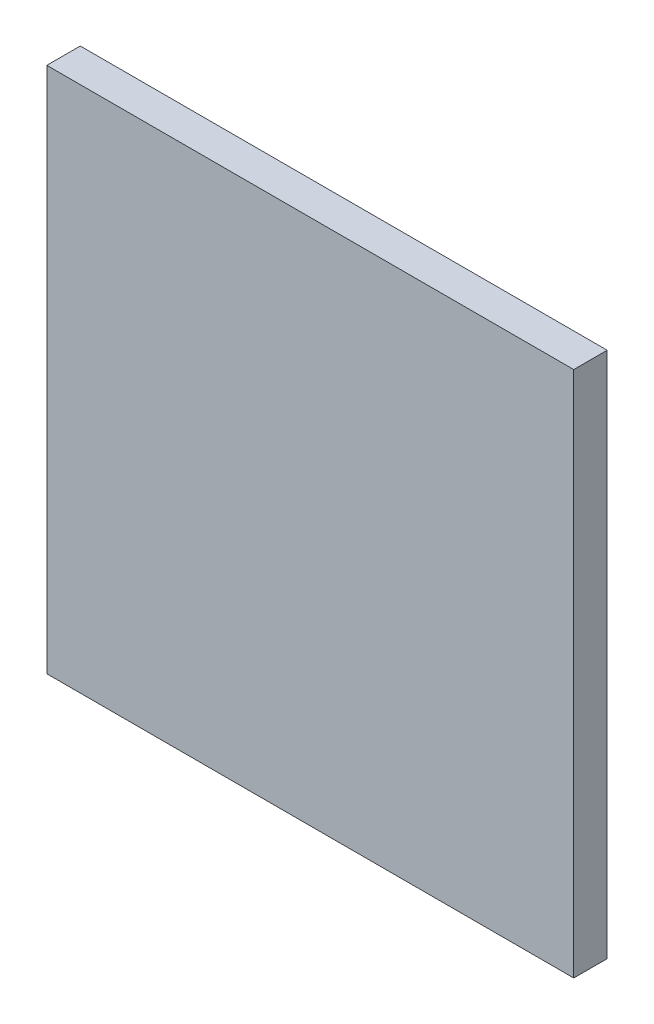
from build123d import *

# Parameters (mm, degrees)
SKETCH1_W  = 6.3
SKETCH1_H  = 6.3
CHIP_DEPTH = 0.4


with BuildPart() as part:
    # Sketch1 → chip (new body)
    with BuildSketch(Plane.XY):
        Rectangle(SKETCH1_W, SKETCH1_H)
    extrude(amount=CHIP_DEPTH)


solid = part.part
